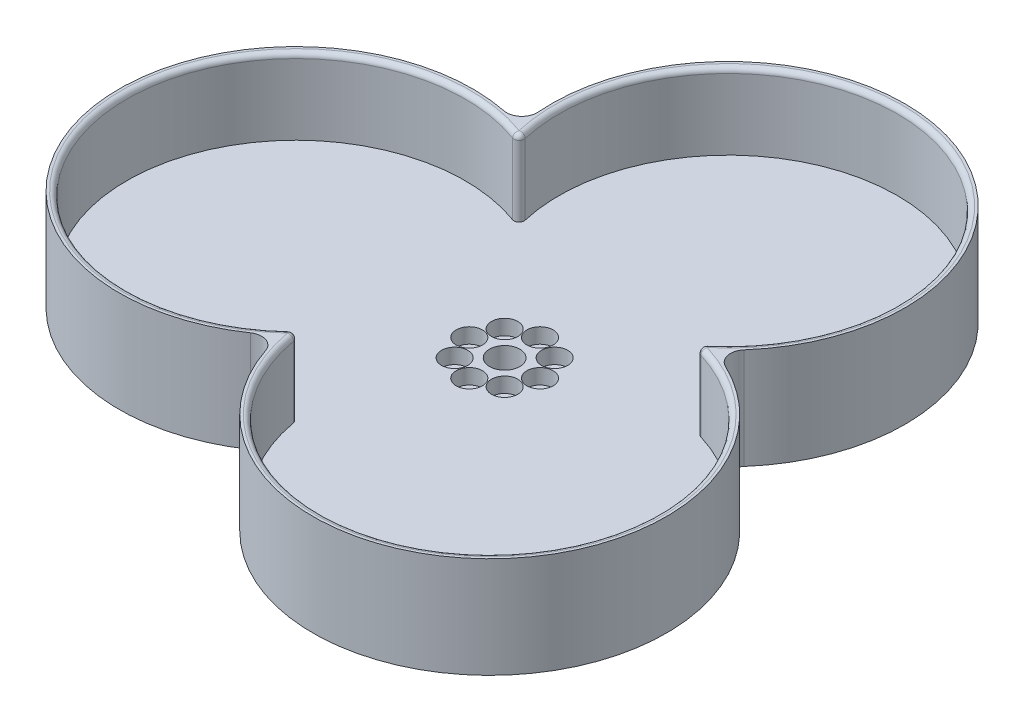
from build123d import *

# Parameters (mm, degrees)
SKETCH_1_R          = 15
SKETCH_1_R_2        = 1.5
SKETCH_1_R_3        = 3
EXTRUDE_1_DEPTH     = 3
SKETCH_2_R          = 1.5
SKETCH_2_R_2        = 3
EXTRUDE_2_DEPTH     = 5
SKETCH_5_R          = 2.6
CUT_EXTRUDE_1_DEPTH = 3
EXTRUDE_3_DEPTH     = 15
FILLET_5_R          = 1
FILLET_6_R          = 1
FILLET_7_R          = 3


with BuildPart() as part:
    # 草图1 → 凸台-拉伸1 (new body)
    with BuildSketch(Plane(origin=(0, 0, 0), x_dir=(1, 0, 0), z_dir=(0, 1, 0))):
        with Locations(Location((0, 0, 0), (0, 0, 270))):
            Circle(SKETCH_1_R)
        with Locations(Location((0, 7, 0), (0, 0, 270))):
            Circle(SKETCH_1_R_2, mode=Mode.SUBTRACT)
        with Locations(Location((4.949747468, 4.949747468, 0), (0, 0, 270))):
            Circle(SKETCH_1_R_2, mode=Mode.SUBTRACT)
        with Locations(Location((7, 0, 0), (0, 0, 270))):
            Circle(SKETCH_1_R_2, mode=Mode.SUBTRACT)
        with Locations(Location((4.949747468, -4.949747468, 0), (0, 0, 270))):
            Circle(SKETCH_1_R_2, mode=Mode.SUBTRACT)
        with Locations(Location((0, -7, 0), (0, 0, 270))):
            Circle(SKETCH_1_R_2, mode=Mode.SUBTRACT)
        with Locations(Location((-4.949747468, -4.949747468, 0), (0, 0, 270))):
            Circle(SKETCH_1_R_2, mode=Mode.SUBTRACT)
        with Locations(Location((-7, 0, 0), (0, 0, 270))):
            Circle(SKETCH_1_R_2, mode=Mode.SUBTRACT)
        with Locations(Location((-4.949747468, 4.949747468, 0), (0, 0, 270))):
            Circle(SKETCH_1_R_2, mode=Mode.SUBTRACT)
        with Locations(Location((0, 0, 0), (0, 0, 270))):
            Circle(SKETCH_1_R_3, mode=Mode.SUBTRACT)
    extrude(amount=EXTRUDE_1_DEPTH)

    # 草图2 → 凸台-拉伸2 (add)
    with BuildSketch(Plane(origin=(0, 3, 0), x_dir=(1, 0, 0), z_dir=(0, 1, 0))):
        with BuildLine():
            ThreePointArc((34.287340692, 7.026967216), (22.116276452, 66.414383351), (-23.229202466, 26.18022446))
            ThreePointArc((-23.229202466, 26.18022446), (-68.574681385, -14.053934431), (-11.058138226, -33.207191676))
            ThreePointArc((-11.058138226, -33.207191676), (46.458404933, -52.36044892), (34.287340692, 7.026967216))
        make_face()
        with Locations(Location((-4.949747468, 4.949747468, 0), (0, 0, 270))):
            Circle(SKETCH_2_R, mode=Mode.SUBTRACT)
        with Locations(Location((-4.949747468, -4.949747468, 0), (0, 0, 270))):
            Circle(SKETCH_2_R, mode=Mode.SUBTRACT)
        with Locations(Location((0, -7, 0), (0, 0, 270))):
            Circle(SKETCH_2_R, mode=Mode.SUBTRACT)
        with Locations(Location((0, 0, 0), (0, 0, 270))):
            Circle(SKETCH_2_R_2, mode=Mode.SUBTRACT)
        with Locations(Location((-7, 0, 0), (0, 0, 270))):
            Circle(SKETCH_2_R, mode=Mode.SUBTRACT)
        with Locations(Location((4.949747468, -4.949747468, 0), (0, 0, 270))):
            Circle(SKETCH_2_R, mode=Mode.SUBTRACT)
        with Locations(Location((7, 0, 0), (0, 0, 270))):
            Circle(SKETCH_2_R, mode=Mode.SUBTRACT)
        with Locations(Location((4.949747468, 4.949747468, 0), (0, 0, 270))):
            Circle(SKETCH_2_R, mode=Mode.SUBTRACT)
        with Locations(Location((0, 7, 0), (0, 0, 270))):
            Circle(SKETCH_2_R, mode=Mode.SUBTRACT)
    extrude(amount=EXTRUDE_2_DEPTH)

    # 草图5 → 切除-拉伸1 (cut)
    with BuildSketch(Plane(origin=(0, 8, 0), x_dir=(1, 0, 0), z_dir=(0, 1, 0))):
        with Locations(Location((0, 7, 0), (0, 0, 270))):
            Circle(SKETCH_5_R)
        with Locations(Location((4.949747468, 4.949747468, 0), (0, 0, 270))):
            Circle(SKETCH_5_R)
        with Locations(Location((7, 0, 0), (0, 0, 270))):
            Circle(SKETCH_5_R)
        with Locations(Location((4.949747468, -4.949747468, 0), (0, 0, 270))):
            Circle(SKETCH_5_R)
        with Locations(Location((0, -7, 0), (0, 0, 270))):
            Circle(SKETCH_5_R)
        with Locations(Location((-4.949747468, -4.949747468, 0), (0, 0, 270))):
            Circle(SKETCH_5_R)
        with Locations(Location((-7, 0, 0), (0, 0, 270))):
            Circle(SKETCH_5_R)
        with Locations(Location((-4.949747468, 4.949747468, 0), (0, 0, 270))):
            Circle(SKETCH_5_R)
    extrude(amount=-CUT_EXTRUDE_1_DEPTH, mode=Mode.SUBTRACT)

    # 草图3 → 凸台-拉伸3 (add)
    with BuildSketch(Plane(origin=(0, 8, 0), x_dir=(1, 0, 0), z_dir=(0, 1, 0))):
        with BuildLine():
            ThreePointArc((34.287340692, 7.026967216), (22.116276452, 66.414383351), (-23.229202466, 26.18022446))
            ThreePointArc((-23.229202466, 26.18022446), (-68.574681385, -14.053934431), (-11.058138226, -33.207191676))
            ThreePointArc((-11.058138226, -33.207191676), (46.458404933, -52.36044892), (34.287340692, 7.026967216))
        make_face()
        with BuildLine():
            ThreePointArc((31.118546415, 6.377543462), (21.642356242, 64.991217994), (-21.08238786, 23.760679994))
            ThreePointArc((-21.08238786, 23.760679994), (-67.105223926, -13.752778694), (-10.036158556, -30.138223456))
            ThreePointArc((-10.036158556, -30.138223456), (45.462867684, -51.2384393), (31.118546415, 6.377543462))
        make_face(mode=Mode.SUBTRACT)
    extrude(amount=EXTRUDE_3_DEPTH)

    # 圆角5
    fillet_5_edges = [part.edges().sort_by_distance(p)[0] for p in [
        (31.118546415, 15.5, -6.377543462),
        (-21.08238786, 15.5, -23.760679994),
        (-10.036158556, 15.5, 30.138223456),
    ]]
    fillet(fillet_5_edges, radius=FILLET_5_R)

    # 圆角6
    fillet_6_edges = [part.edges().sort_by_distance(p)[0] for p in [
        (-67.105223926, 23, 13.752778694),
        (45.462867684, 23, 51.2384393),
        (21.642356242, 23, -64.991217994),
        (-21.886725168, 23, -24.667199764),
        (32.30578422, 23, -6.620860119),
        (-10.419059052, 23, 31.288059883),
    ]]
    fillet(fillet_6_edges, radius=FILLET_6_R - 0.0004)  # a hair under: the kernel refuses the full size

    # 圆角7
    fillet_7_edges = [part.edges().sort_by_distance(p)[0] for p in [
        (-11.058138226, 13, 33.207191676),
        (34.287340692, 13, -7.026967216),
        (-23.229202466, 13, -26.18022446),
    ]]
    fillet(fillet_7_edges, radius=FILLET_7_R)


solid = part.part
